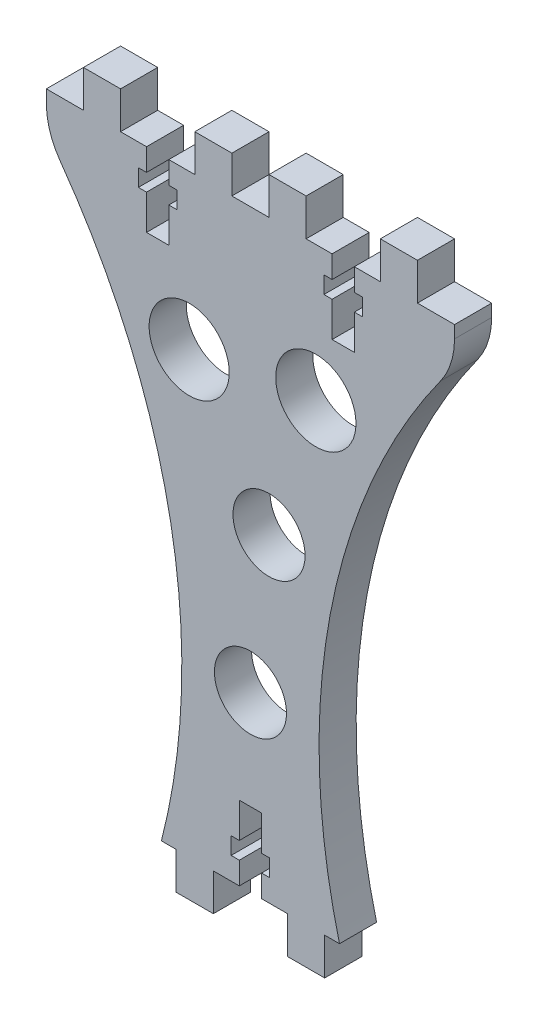
from build123d import *

# Parameters (mm, degrees)
ESQUISSE1_R        = 4.85477379
ESQUISSE1_R_2      = 5.395392345
ESQUISSE1_R_3      = 4.854658012
ESQUISSE1_R_4      = 5.406629484
BOSS_EXTRU_1_DEPTH = 5
CONG_1_R           = 10


with BuildPart() as part:
    # Esquisse1 → Boss.-Extru.1 (new body)
    with BuildSketch(Plane.XY):
        with BuildLine():
            Line((-12, 0), (-10, 0))
            Line((-10, 0), (-10, -5))
            Line((-10, -5), (-5, -5))
            Line((-5, -5), (-5, 0))
            Line((-5, 0), (-1.5, 0))
            Line((-1.5, 0), (-1.5, 3))
            Line((-1.5, 3), (-2.6, 3))
            Line((-2.6, 3), (-2.6, 5.3))
            Line((-2.6, 5.3), (-1.5, 5.3))
            Line((-1.5, 5.3), (-1.5, 10))
            Line((-1.5, 10), (1.5, 10))
            Line((1.5, 10), (1.5, 5.3))
            Line((1.5, 5.3), (2.6, 5.3))
            Line((2.6, 5.3), (2.6, 3))
            Line((2.6, 3), (1.5, 3))
            Line((1.5, 3), (1.5, 0))
            Line((1.5, 0), (5, 0))
            Line((5, 0), (5, -5))
            Line((5, -5), (10, -5))
            Line((10, -5), (10, 0))
            Line((10, 0), (12, 0))
            ThreePointArc((12, 0), (11.041720581, 39.29971108), (27.5, 75))
            Line((27.5, 75), (27.5, 80))
            Line((27.5, 80), (22.5, 80))
            Line((22.5, 80), (22.5, 85))
            Line((22.5, 85), (17.5, 85))
            Line((17.5, 85), (17.5, 80))
            Line((17.5, 80), (14, 80))
            Line((14, 80), (14, 77))
            Line((14, 77), (15.1, 77))
            Line((15.1, 77), (15.1, 74.7))
            Line((15.1, 74.7), (14, 74.7))
            Line((14, 74.7), (14, 70))
            Line((14, 70), (11, 70))
            Line((11, 70), (11, 74.7))
            Line((11, 74.7), (9.9, 74.7))
            Line((9.9, 74.7), (9.9, 77))
            Line((9.9, 77), (11, 77))
            Line((11, 77), (11, 80))
            Line((11, 80), (7.5, 80))
            Line((7.5, 80), (7.5, 85))
            Line((7.5, 85), (2.5, 85))
            Line((2.5, 85), (2.5, 80))
            Line((2.5, 80), (-2.5, 80))
            Line((-2.5, 80), (-2.5, 85))
            Line((-2.5, 85), (-7.5, 85))
            Line((-7.5, 85), (-7.5, 80))
            Line((-7.5, 80), (-11, 80))
            Line((-11, 80), (-11, 77))
            Line((-11, 77), (-9.9, 77))
            Line((-9.9, 77), (-9.9, 74.7))
            Line((-9.9, 74.7), (-11, 74.7))
            Line((-11, 74.7), (-11, 70))
            Line((-11, 70), (-14, 70))
            Line((-14, 70), (-14, 74.7))
            Line((-14, 74.7), (-15.1, 74.7))
            Line((-15.1, 74.7), (-15.1, 77))
            Line((-15.1, 77), (-14, 77))
            Line((-14, 77), (-14, 80))
            Line((-14, 80), (-17.5, 80))
            Line((-17.5, 80), (-17.5, 85))
            Line((-17.5, 85), (-22.5, 85))
            Line((-22.5, 85), (-22.5, 80))
            Line((-22.5, 80), (-27.5, 80))
            Line((-27.5, 80), (-27.5, 75))
            ThreePointArc((-27.5, 75), (-11.041720581, 39.29971108), (-12, 0))
        make_face()
        with Locations((0, 23.296406786)):
            Circle(ESQUISSE1_R, mode=Mode.SUBTRACT)
        with Locations((-8.255855023, 59.216067313)):
            Circle(ESQUISSE1_R_2, mode=Mode.SUBTRACT)
        with Locations((2.5, 42.939171871)):
            Circle(ESQUISSE1_R_3, mode=Mode.SUBTRACT)
        with Locations((8.808797144, 61.794180231)):
            Circle(ESQUISSE1_R_4, mode=Mode.SUBTRACT)
    extrude(amount=BOSS_EXTRU_1_DEPTH)

    # Congé1
    cong_1_edges = [part.edges().sort_by_distance(p)[0] for p in [
        (-27.5, 75, 2.5),
        (27.5, 75, 2.5),
    ]]
    fillet(cong_1_edges, radius=CONG_1_R)


solid = part.part
